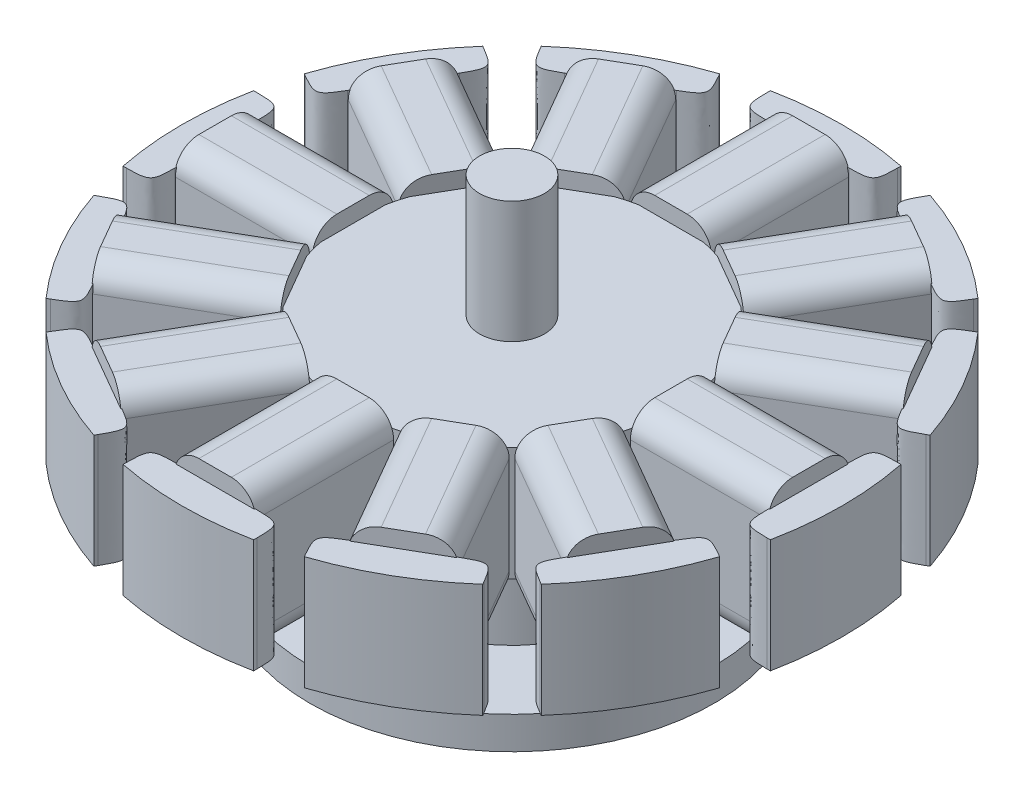
from build123d import *

# Parameters (mm, degrees)
SKETCH_1_R                          = 10
EXTRUDE_4034_DEPTH                  = 7
SKETCH_2_R                          = 7.25
EXTRUDE_4097_DEPTH                  = 7.5
EXTRUDE_START                       = -7.5
SKETCH_3_R                          = 12.45
EXTRUDE_4165_DEPTH                  = 2
SKETCH_4_R                          = 1.5
CUT_EXTRUDE_4303_DEPTH              = 20.137789841
EXTRUDE_START_2                     = -9.5
SKETCH_5_R                          = 2
EXTRUDE_4376_DEPTH                  = 24
CHAMFER_1_SIZE                      = 0.5
SKETCH_6_W                          = 4
SKETCH_6_H                          = 8.45002025
EXTRUDE_6494_DEPTH                  = 7
EXTRUDE_START_3                     = 9.797959
SKETCH_8_W                          = 5
SKETCH_8_H                          = 9
EXTRUDE_6645_DEPTH                  = 8.5
FILLET_1_R                          = 1.5
FILLET_2_SIZE                       = 1.5
PATTERN_CIRCULAR_2_COUNT            = 12
FILLET_1_OF_PATTERN_CIRCULAR_2_R    = 1.5
FILLET_2_OF_PATTERN_CIRCULAR_2_SIZE = 1.5


with BuildPart() as part:
    # Эскиз1 → Extrude 4034 (new body)
    with BuildSketch(Plane(origin=(0, 0, 0), x_dir=(1, 0, 0), z_dir=(0, 1, 0))):
        with Locations(Location((0, 0, 0), (0, 0, 270))):
            Circle(SKETCH_1_R)
    extrude(amount=EXTRUDE_4034_DEPTH)

    # Эскиз2 → Extrude 4097 (add)
    with BuildSketch(Plane(origin=(0, 0, 0), x_dir=(1, 0, 0), z_dir=(0, 1, 0))):
        with Locations(Location((0, 0, 0), (0, 0, 270))):
            Circle(SKETCH_2_R)
    extrude(amount=-EXTRUDE_4097_DEPTH)

    # Эскиз3 → Extrude 4165 (add)
    with BuildSketch(Plane(origin=(0, 0, 0), x_dir=(1, 0, 0), z_dir=(0, 1, 0)).offset(EXTRUDE_START)):
        with Locations(Location((0, 0, 0), (0, 0, 270))):
            Circle(SKETCH_3_R)
    extrude(amount=EXTRUDE_4165_DEPTH)

    # Эскиз4 → Cut-Extrude 4303 (cut, through all)
    with BuildSketch(Plane(origin=(0, 0, 0), x_dir=(1, 0, 0), z_dir=(0, 1, 0))):
        with Locations(Location((-8, 0, 0), (0, 0, 270))):
            Circle(SKETCH_4_R)
        with Locations(Location((0, -9.5, 0), (0, 0, 270))):
            Circle(SKETCH_4_R)
        with Locations(Location((8, 0, 0), (0, 0, 270))):
            Circle(SKETCH_4_R)
        with Locations(Location((0, 9.5, 0), (0, 0, 270))):
            Circle(SKETCH_4_R)
    extrude(amount=-CUT_EXTRUDE_4303_DEPTH, mode=Mode.SUBTRACT)

    # Эскиз5 → Extrude 4376 (add)
    with BuildSketch(Plane(origin=(0, 0, 0), x_dir=(1, 0, 0), z_dir=(0, 1, 0)).offset(EXTRUDE_START_2)):
        with Locations(Location((0, 0, 0), (0, 0, 270))):
            Circle(SKETCH_5_R)
    extrude(amount=EXTRUDE_4376_DEPTH)

    # Фаска1
    chamfer_1_edges = [part.edges().sort_by_distance(p)[0] for p in [
        (0, -9.5, -2),
    ]]
    chamfer(chamfer_1_edges, length=CHAMFER_1_SIZE)

    # Эскиз6 → Extrude 6494 (add)
    with BuildSketch(Plane(origin=(0, 0, 0), x_dir=(1, 0, 0), z_dir=(0, 1, 0))):
        with BuildLine():
            Line((4.025, 18.247979221), (4.025, 19.947979221))
            ThreePointArc((4.025, 19.947979221), (0, 20.35), (-4.025, 19.947979221))
            Line((-4.025, 19.947979221), (-4.025, 18.247979221))
            Line((-4.025, 18.247979221), (-2, 18.247979221))
            Line((-2, 18.247979221), (2, 18.247979221))
            Line((2, 18.247979221), (4.025, 18.247979221))
        make_face()
        with Locations((0, 14.022969096)):
            Rectangle(SKETCH_6_W, SKETCH_6_H)
        with BuildLine():
            Line((12.609741861, 13.790713573), (13.459741861, 15.26295676))
            ThreePointArc((13.459741861, 15.26295676), (10.175, 17.623616967), (6.48823736, 19.28795676))
            Line((6.48823736, 19.28795676), (5.63823736, 17.815713573))
            Line((5.63823736, 17.815713573), (7.391938803, 16.803213573))
            Line((7.391938803, 16.803213573), (3.166928678, 9.485281374))
            Line((3.166928678, 9.485281374), (6.631030293, 7.485281374))
            Line((6.631030293, 7.485281374), (10.856040418, 14.803213573))
            Line((10.856040418, 14.803213573), (12.609741861, 13.790713573))
        make_face()
        with BuildLine():
            Line((17.815713573, 5.63823736), (19.28795676, 6.48823736))
            ThreePointArc((19.28795676, 6.48823736), (17.623616967, 10.175), (15.26295676, 13.459741861))
            Line((15.26295676, 13.459741861), (13.790713573, 12.609741861))
            Line((13.790713573, 12.609741861), (14.803213573, 10.856040418))
            Line((14.803213573, 10.856040418), (7.485281374, 6.631030293))
            Line((7.485281374, 6.631030293), (9.485281374, 3.166928678))
            Line((9.485281374, 3.166928678), (16.803213573, 7.391938803))
            Line((16.803213573, 7.391938803), (17.815713573, 5.63823736))
        make_face()
        with BuildLine():
            Line((18.247979221, -4.025), (19.947979221, -4.025))
            ThreePointArc((19.947979221, -4.025), (20.35, 0), (19.947979221, 4.025))
            Line((19.947979221, 4.025), (18.247979221, 4.025))
            Line((18.247979221, 4.025), (18.247979221, 2))
            Line((18.247979221, 2), (9.797958971, 2))
            Line((9.797958971, 2), (9.797958971, -2))
            Line((9.797958971, -2), (18.247979221, -2))
            Line((18.247979221, -2), (18.247979221, -4.025))
        make_face()
        with BuildLine():
            Line((13.790713573, -12.609741861), (15.26295676, -13.459741861))
            ThreePointArc((15.26295676, -13.459741861), (17.623616967, -10.175), (19.28795676, -6.48823736))
            Line((19.28795676, -6.48823736), (17.815713573, -5.63823736))
            Line((17.815713573, -5.63823736), (16.803213573, -7.391938803))
            Line((16.803213573, -7.391938803), (9.485281374, -3.166928678))
            Line((9.485281374, -3.166928678), (7.485281374, -6.631030293))
            Line((7.485281374, -6.631030293), (14.803213573, -10.856040418))
            Line((14.803213573, -10.856040418), (13.790713573, -12.609741861))
        make_face()
        with BuildLine():
            Line((5.63823736, -17.815713573), (6.48823736, -19.28795676))
            ThreePointArc((6.48823736, -19.28795676), (10.175, -17.623616967), (13.459741861, -15.26295676))
            Line((13.459741861, -15.26295676), (12.609741861, -13.790713573))
            Line((12.609741861, -13.790713573), (10.856040418, -14.803213573))
            Line((10.856040418, -14.803213573), (6.631030293, -7.485281374))
            Line((6.631030293, -7.485281374), (3.166928678, -9.485281374))
            Line((3.166928678, -9.485281374), (7.391938803, -16.803213573))
            Line((7.391938803, -16.803213573), (5.63823736, -17.815713573))
        make_face()
        with BuildLine():
            Line((-4.025, -18.247979221), (-4.025, -19.947979221))
            ThreePointArc((-4.025, -19.947979221), (0, -20.35), (4.025, -19.947979221))
            Line((4.025, -19.947979221), (4.025, -18.247979221))
            Line((4.025, -18.247979221), (2, -18.247979221))
            Line((2, -18.247979221), (2, -9.797958971))
            Line((2, -9.797958971), (-2, -9.797958971))
            Line((-2, -9.797958971), (-2, -18.247979221))
            Line((-2, -18.247979221), (-4.025, -18.247979221))
        make_face()
        with BuildLine():
            Line((-12.609741861, -13.790713573), (-13.459741861, -15.26295676))
            ThreePointArc((-13.459741861, -15.26295676), (-10.175, -17.623616967), (-6.48823736, -19.28795676))
            Line((-6.48823736, -19.28795676), (-5.63823736, -17.815713573))
            Line((-5.63823736, -17.815713573), (-7.391938803, -16.803213573))
            Line((-7.391938803, -16.803213573), (-3.166928678, -9.485281374))
            Line((-3.166928678, -9.485281374), (-6.631030293, -7.485281374))
            Line((-6.631030293, -7.485281374), (-10.856040418, -14.803213573))
            Line((-10.856040418, -14.803213573), (-12.609741861, -13.790713573))
        make_face()
        with BuildLine():
            Line((-17.815713573, -5.63823736), (-19.28795676, -6.48823736))
            ThreePointArc((-19.28795676, -6.48823736), (-17.623616967, -10.175), (-15.26295676, -13.459741861))
            Line((-15.26295676, -13.459741861), (-13.790713573, -12.609741861))
            Line((-13.790713573, -12.609741861), (-14.803213573, -10.856040418))
            Line((-14.803213573, -10.856040418), (-7.485281374, -6.631030293))
            Line((-7.485281374, -6.631030293), (-9.485281374, -3.166928678))
            Line((-9.485281374, -3.166928678), (-16.803213573, -7.391938803))
            Line((-16.803213573, -7.391938803), (-17.815713573, -5.63823736))
        make_face()
        with BuildLine():
            Line((-18.247979221, 4.025), (-19.947979221, 4.025))
            ThreePointArc((-19.947979221, 4.025), (-20.35, 0), (-19.947979221, -4.025))
            Line((-19.947979221, -4.025), (-18.247979221, -4.025))
            Line((-18.247979221, -4.025), (-18.247979221, -2))
            Line((-18.247979221, -2), (-9.797958971, -2))
            Line((-9.797958971, -2), (-9.797958971, 2))
            Line((-9.797958971, 2), (-18.247979221, 2))
            Line((-18.247979221, 2), (-18.247979221, 4.025))
        make_face()
        with BuildLine():
            Line((-13.790713573, 12.609741861), (-15.26295676, 13.459741861))
            ThreePointArc((-15.26295676, 13.459741861), (-17.623616967, 10.175), (-19.28795676, 6.48823736))
            Line((-19.28795676, 6.48823736), (-17.815713573, 5.63823736))
            Line((-17.815713573, 5.63823736), (-16.803213573, 7.391938803))
            Line((-16.803213573, 7.391938803), (-9.485281374, 3.166928678))
            Line((-9.485281374, 3.166928678), (-7.485281374, 6.631030293))
            Line((-7.485281374, 6.631030293), (-14.803213573, 10.856040418))
            Line((-14.803213573, 10.856040418), (-13.790713573, 12.609741861))
        make_face()
        with BuildLine():
            Line((-5.63823736, 17.815713573), (-6.48823736, 19.28795676))
            ThreePointArc((-6.48823736, 19.28795676), (-10.175, 17.623616967), (-13.459741861, 15.26295676))
            Line((-13.459741861, 15.26295676), (-12.609741861, 13.790713573))
            Line((-12.609741861, 13.790713573), (-10.856040418, 14.803213573))
            Line((-10.856040418, 14.803213573), (-6.631030293, 7.485281374))
            Line((-6.631030293, 7.485281374), (-3.166928678, 9.485281374))
            Line((-3.166928678, 9.485281374), (-7.391938803, 16.803213573))
            Line((-7.391938803, 16.803213573), (-5.63823736, 17.815713573))
        make_face()
    extrude(amount=EXTRUDE_6494_DEPTH)

    # Эскиз8 → Extrude 6645 (add)
    with BuildSketch(Plane.XY.offset(EXTRUDE_START_3)):
        with Locations((0, 3.5)):
            Rectangle(SKETCH_8_W, SKETCH_8_H)
    extrude_6645 = extrude(amount=EXTRUDE_6645_DEPTH)

    # Скругление1
    fillet_1_edges = [part.edges().sort_by_distance(p)[0] for p in [
        (2.5, -1, 14.047959),
        (-2.5, -1, 14.047959),
        (-2.5, 8, 14.047959),
        (2.5, 8, 14.047959),
    ]]
    fillet(fillet_1_edges, radius=FILLET_1_R)

    # Скругление2
    # a fillet whose section is not a circle: 1.5 mm, written as the material it takes off along each edge
    with BuildSketch(Plane(origin=(4.025, -3.75, 18.247979221), x_dir=(-1, 0, 0), z_dir=(0, 1, 0))) as fillet_2_piece_1:
        with BuildLine():
            Bezier((FILLET_2_SIZE, 0), (0, 0), (0, FILLET_2_SIZE), weights=[1, 2.333333333, 1])
            Line((0, FILLET_2_SIZE), (0, 0))
            Line((0, 0), (FILLET_2_SIZE, 0))
        make_face()
    extrude(amount=14.5, mode=Mode.SUBTRACT)
    with BuildSketch(Plane(origin=(-4.025, -3.75, 18.247979221), x_dir=(1, 0, 0), z_dir=(0, 1, 0))) as fillet_2_piece_2:
        with BuildLine():
            Bezier((FILLET_2_SIZE, 0), (0, 0), (0, -FILLET_2_SIZE), weights=[1, 2.333333333, 1])
            Line((0, -FILLET_2_SIZE), (0, 0))
            Line((0, 0), (FILLET_2_SIZE, 0))
        make_face()
    extrude(amount=14.5, mode=Mode.SUBTRACT)

    # Круговой массив2: Extrude 6645 ×12 about axis
    pattern_circular_2_axis = Axis((0, 14.5, 0), (0, -1, 0))
    for i in range(1, PATTERN_CIRCULAR_2_COUNT):
        add(extrude_6645.rotate(pattern_circular_2_axis, i * 360 / PATTERN_CIRCULAR_2_COUNT))

    # Скругление1 of Круговой массив2
    fillet_1_of_pattern_circular_2_edges = [part.edges().sort_by_distance(p)[0] for p in [
        (-4.858915991, -1, 13.415889365),
        (-9.189043009, -1, 10.915889365),
        (-9.189043009, 8, 10.915889365),
        (-4.858915991, 8, 13.415889365),
        (-10.915889365, -1, 9.189043009),
        (-13.415889365, -1, 4.858915991),
        (-13.415889365, 8, 4.858915991),
        (-10.915889365, 8, 9.189043009),
        (-14.047959, -1, 2.5),
        (-14.047959, -1, -2.5),
        (-14.047959, 8, -2.5),
        (-14.047959, 8, 2.5),
        (-13.415889365, -1, -4.858915991),
        (-10.915889365, -1, -9.189043009),
        (-10.915889365, 8, -9.189043009),
        (-13.415889365, 8, -4.858915991),
        (-9.189043009, -1, -10.915889365),
        (-4.858915991, -1, -13.415889365),
        (-4.858915991, 8, -13.415889365),
        (-9.189043009, 8, -10.915889365),
        (-2.5, -1, -14.047959),
        (2.5, -1, -14.047959),
        (2.5, 8, -14.047959),
        (-2.5, 8, -14.047959),
        (4.858915991, -1, -13.415889365),
        (9.189043009, -1, -10.915889365),
        (9.189043009, 8, -10.915889365),
        (4.858915991, 8, -13.415889365),
        (10.915889365, -1, -9.189043009),
        (13.415889365, -1, -4.858915991),
        (13.415889365, 8, -4.858915991),
        (10.915889365, 8, -9.189043009),
        (14.047959, -1, -2.5),
        (14.047959, -1, 2.5),
        (14.047959, 8, 2.5),
        (14.047959, 8, -2.5),
        (13.415889365, -1, 4.858915991),
        (10.915889365, -1, 9.189043009),
        (10.915889365, 8, 9.189043009),
        (13.415889365, 8, 4.858915991),
        (9.189043009, -1, 10.915889365),
        (4.858915991, -1, 13.415889365),
        (4.858915991, 8, 13.415889365),
        (9.189043009, 8, 10.915889365),
    ]]
    fillet(fillet_1_of_pattern_circular_2_edges, radius=FILLET_1_OF_PATTERN_CIRCULAR_2_R)

    # Скругление2 of Круговой массив2
    # a fillet whose section is not a circle: 1.5 mm, written as the material it takes off along each edge
    with BuildSketch(Plane(origin=(-5.63823736, -3.75, 17.815713573), x_dir=(-0.8660254037844288, 0, -0.500000000000017), z_dir=(0, 1, 0)), Plane(origin=(-13.790713573, -3.75, 12.609741861), x_dir=(-0.499999999999982, 0, -0.8660254037844489), z_dir=(0, 1, 0)), Plane(origin=(-18.247979221, -3.75, 4.025), x_dir=(0, 0, -1), z_dir=(0, 1, 0)), Plane(origin=(-17.815713573, -3.75, -5.63823736), x_dir=(0.5000000000000252, 0, -0.866025403784424), z_dir=(0, 1, 0)), Plane(origin=(-12.609741861, -3.75, -13.790713573), x_dir=(0.866025403784452, 0, -0.49999999999997696), z_dir=(0, 1, 0)), Plane(origin=(-4.025, -3.75, -18.247979221), x_dir=(1, 0, 0), z_dir=(0, 1, 0)), Plane(origin=(5.63823736, -3.75, -17.815713573), x_dir=(0.8660254037844374, 0, 0.5000000000000023), z_dir=(0, 1, 0)), Plane(origin=(13.790713573, -3.75, -12.609741861), x_dir=(0.49999999999999684, 0, 0.8660254037844405), z_dir=(0, 1, 0)), Plane(origin=(18.247979221, -3.75, -4.025), x_dir=(0, 0, 1), z_dir=(0, 1, 0)), Plane(origin=(17.815713573, -3.75, 5.63823736), x_dir=(-0.5000000000000137, 0, 0.8660254037844307), z_dir=(0, 1, 0)), Plane(origin=(12.609741861, -3.75, 13.790713573), x_dir=(-0.8660254037844453, 0, 0.4999999999999884), z_dir=(0, 1, 0))) as fillet_2_of_pattern_circular_2_piece_1:
        with BuildLine():
            Bezier((FILLET_2_OF_PATTERN_CIRCULAR_2_SIZE, 0), (0, 0), (0, FILLET_2_OF_PATTERN_CIRCULAR_2_SIZE), weights=[1, 2.333333333, 1])
            Line((0, FILLET_2_OF_PATTERN_CIRCULAR_2_SIZE), (0, 0))
            Line((0, 0), (FILLET_2_OF_PATTERN_CIRCULAR_2_SIZE, 0))
        make_face()
    extrude(amount=14.5, mode=Mode.SUBTRACT)
    with BuildSketch(Plane(origin=(-12.609741861, -3.75, 13.790713573), x_dir=(0.8660254037844316, 0, 0.5000000000000123), z_dir=(0, 1, 0)), Plane(origin=(-17.815713573, -3.75, 5.63823736), x_dir=(0.49999999999998496, 0, 0.8660254037844474), z_dir=(0, 1, 0)), Plane(origin=(-18.247979221, -3.75, -4.025), x_dir=(0, 0, 1), z_dir=(0, 1, 0)), Plane(origin=(-13.790713573, -3.75, -12.609741861), x_dir=(-0.5000000000000188, 0, 0.8660254037844277), z_dir=(0, 1, 0)), Plane(origin=(-5.63823736, -3.75, -17.815713573), x_dir=(-0.8660254037844507, 0, 0.49999999999997913), z_dir=(0, 1, 0)), Plane(origin=(4.025, -3.75, -18.247979221), x_dir=(-1, 0, 0), z_dir=(0, 1, 0)), Plane(origin=(12.609741861, -3.75, -13.790713573), x_dir=(-0.8660254037844375, 0, -0.5000000000000019), z_dir=(0, 1, 0)), Plane(origin=(17.815713573, -3.75, -5.63823736), x_dir=(-0.49999999999999517, 0, -0.8660254037844415), z_dir=(0, 1, 0)), Plane(origin=(18.247979221, -3.75, 4.025), x_dir=(0, 0, -1), z_dir=(0, 1, 0)), Plane(origin=(13.790713573, -3.75, 12.609741861), x_dir=(0.5000000000000046, 0, -0.866025403784436), z_dir=(0, 1, 0)), Plane(origin=(5.63823736, -3.75, 17.815713573), x_dir=(0.8660254037844441, 0, -0.4999999999999906), z_dir=(0, 1, 0))) as fillet_2_of_pattern_circular_2_piece_2:
        with BuildLine():
            Bezier((FILLET_2_OF_PATTERN_CIRCULAR_2_SIZE, 0), (0, 0), (0, -FILLET_2_OF_PATTERN_CIRCULAR_2_SIZE), weights=[1, 2.333333333, 1])
            Line((0, -FILLET_2_OF_PATTERN_CIRCULAR_2_SIZE), (0, 0))
            Line((0, 0), (FILLET_2_OF_PATTERN_CIRCULAR_2_SIZE, 0))
        make_face()
    extrude(amount=14.5, mode=Mode.SUBTRACT)


solid = part.part
